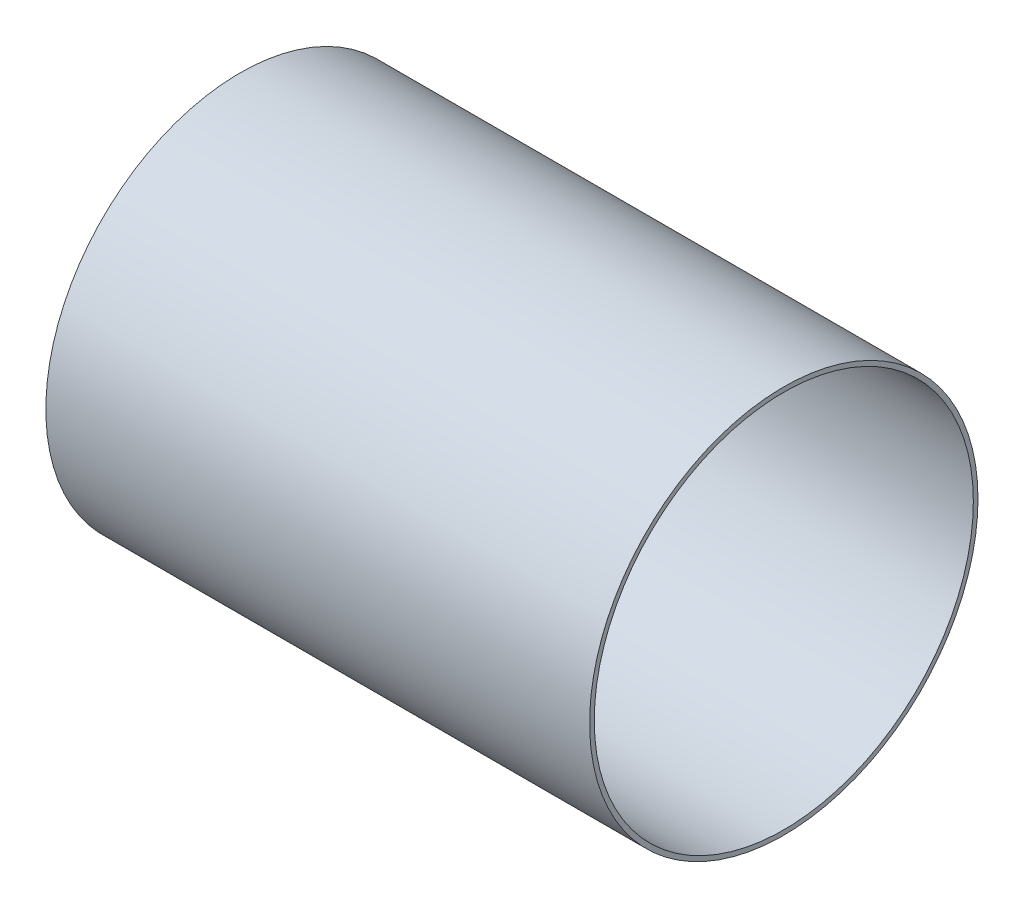
from build123d import *

# Parameters (mm, degrees)
SKETCH1_R           = 125
SKETCH1_R_2         = 122
BOSS_EXTRUDE1_DEPTH = 350


with BuildPart() as part:
    # Sketch1 → Boss-Extrude1 (new body)
    with BuildSketch(Plane(origin=(0, 0, 0), x_dir=(0, 0, -1), z_dir=(1, 0, 0))):
        Circle(SKETCH1_R)
        Circle(SKETCH1_R_2, mode=Mode.SUBTRACT)
    extrude(amount=BOSS_EXTRUDE1_DEPTH)


solid = part.part
